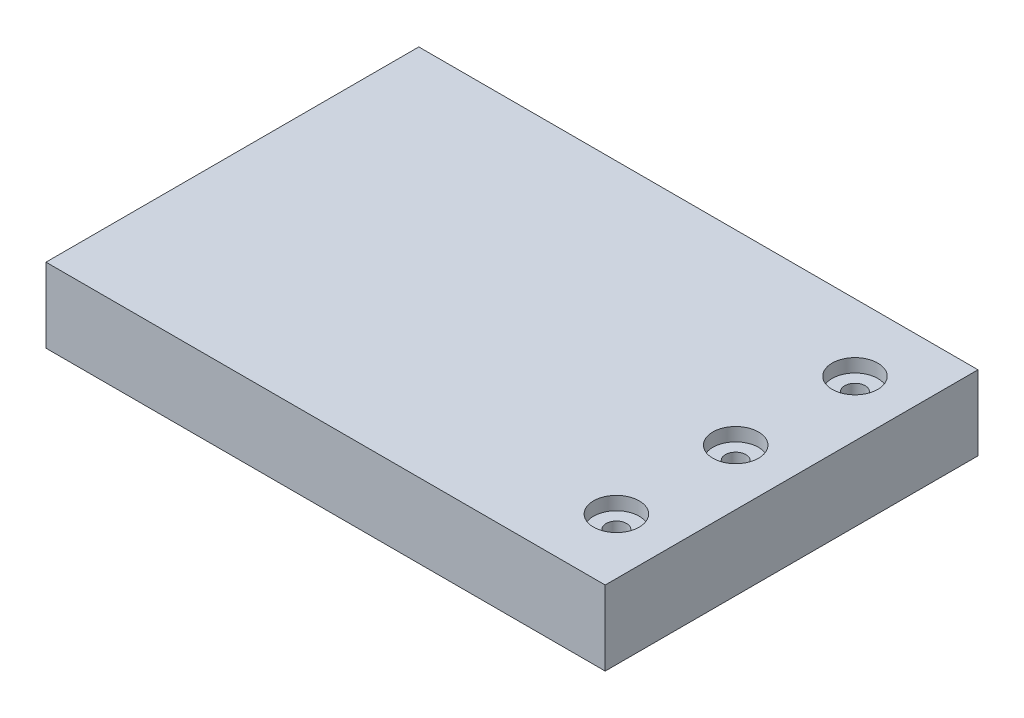
from build123d import *

# Parameters (mm, degrees)
SKETCH1_W                               = 150
SKETCH1_H                               = 100
BOSS_EXTRUDE1_DEPTH                     = 20
CBORE_FOR_M5_HEX_HEAD_BOLT1_D           = 5.5
CBORE_FOR_M5_HEX_HEAD_BOLT1_DEPTH       = 15
CBORE_FOR_M5_HEX_HEAD_BOLT1_CBORE_D     = 12.24
CBORE_FOR_M5_HEX_HEAD_BOLT1_CBORE_DEPTH = 3.58
CBORE_FOR_M5_HEX_HEAD_BOLT1_TIP         = 1.652366702
SHELL1_START                            = 1.4
SHELL1_OUTLINE_W                        = 147.2
SHELL1_OUTLINE_H                        = 97.2
SHELL1_OUTLINE_R                        = 7.52
SHELL1_DEPTH                            = 17.2
SHELL1_2_OUTLINE_R                      = 7.52
SHELL1_2_OUTLINE_R_2                    = 4.15
SHELL1_2_DEPTH                          = 13.62
SHELL1_3_OUTLINE_R                      = 4.15
SHELL1_3_DEPTH                          = 0.314346442


with BuildPart() as part:
    # Sketch1 → Boss-Extrude1 (new body)
    with BuildSketch(Plane(origin=(0, 0, 0), x_dir=(1, 0, 0), z_dir=(0, 1, 0))):
        Rectangle(SKETCH1_W, SKETCH1_H)
    extrude(amount=BOSS_EXTRUDE1_DEPTH)

    # CBORE for M5 Hex Head Bolt1
    with Locations(Plane(origin=(0, 20, 0), x_dir=(1, 0, 0), z_dir=(0, 1, 0))):
        with Locations((60, 0), (60, 32), (60, -32)):
            CounterBoreHole(CBORE_FOR_M5_HEX_HEAD_BOLT1_D / 2, CBORE_FOR_M5_HEX_HEAD_BOLT1_CBORE_D / 2, CBORE_FOR_M5_HEX_HEAD_BOLT1_CBORE_DEPTH, depth=CBORE_FOR_M5_HEX_HEAD_BOLT1_DEPTH)
            with Locations((0, 0, -(CBORE_FOR_M5_HEX_HEAD_BOLT1_DEPTH + CBORE_FOR_M5_HEX_HEAD_BOLT1_TIP / 2))):  # 118° drill point
                Cone(0, CBORE_FOR_M5_HEX_HEAD_BOLT1_D / 2, CBORE_FOR_M5_HEX_HEAD_BOLT1_TIP, mode=Mode.SUBTRACT)

    # Shell1: read off the stored shape, not the designer's step
    # Shell1 outline → Shell1 (cut)
    with BuildSketch(Plane(origin=(0, 0, 0), x_dir=(1, 0, 0), z_dir=(0, 1, 0)).offset(SHELL1_START)):
        Rectangle(SHELL1_OUTLINE_W, SHELL1_OUTLINE_H)
        with Locations((60, -32)):
            Circle(SHELL1_OUTLINE_R, mode=Mode.SUBTRACT)
        with Locations((60, 0)):
            Circle(SHELL1_OUTLINE_R, mode=Mode.SUBTRACT)
        with Locations((60, 32)):
            Circle(SHELL1_OUTLINE_R, mode=Mode.SUBTRACT)
    extrude(amount=SHELL1_DEPTH, mode=Mode.SUBTRACT)

    # Shell1 2 outline → Shell1 2 (cut)
    # profile 1 of 3: a face of its own
    with BuildSketch(Plane(origin=(0, 0, 0), x_dir=(1, 0, 0), z_dir=(0, 1, 0)).offset(SHELL1_START)):
        with Locations((60, -32)):
            Circle(SHELL1_2_OUTLINE_R)
        with Locations((60, -32)):
            Circle(SHELL1_2_OUTLINE_R_2, mode=Mode.SUBTRACT)
    # profile 2 of 3: a face of its own
    with BuildSketch(Plane(origin=(0, 0, 0), x_dir=(1, 0, 0), z_dir=(0, 1, 0)).offset(SHELL1_START)):
        with Locations((60, 32)):
            Circle(SHELL1_2_OUTLINE_R)
        with Locations((60, 32)):
            Circle(SHELL1_2_OUTLINE_R_2, mode=Mode.SUBTRACT)
    # profile 3 of 3: a face of its own
    with BuildSketch(Plane(origin=(0, 0, 0), x_dir=(1, 0, 0), z_dir=(0, 1, 0)).offset(SHELL1_START)):
        with Locations((60, 0)):
            Circle(SHELL1_2_OUTLINE_R)
        with Locations((60, 0)):
            Circle(SHELL1_2_OUTLINE_R_2, mode=Mode.SUBTRACT)
    extrude(amount=SHELL1_2_DEPTH, mode=Mode.SUBTRACT)

    # Shell1 3 outline → Shell1 3 (cut)
    with BuildSketch(Plane(origin=(0, 0, 0), x_dir=(1, 0, 0), z_dir=(0, 1, 0)).offset(SHELL1_START)):
        with Locations((60, -32)):
            Circle(SHELL1_3_OUTLINE_R)
        with Locations((60, 32)):
            Circle(SHELL1_3_OUTLINE_R)
        with Locations((60, 0)):
            Circle(SHELL1_3_OUTLINE_R)
    extrude(amount=SHELL1_3_DEPTH, mode=Mode.SUBTRACT)

    # Shell1 4 outline → Shell1 4 (revolve, cut)
    with BuildSketch(Plane(origin=(60, 0, 32), x_dir=(1, 0, 0), z_dir=(0, 0, 1))):
        Polygon((4.15, 4.207918111), (0, 1.714346542), (4.15, 1.714346442), align=None)
    revolve(axis=Axis((60, 0, 32), (0, 1, 0)), mode=Mode.SUBTRACT)

    # Shell1 5 outline → Shell1 5 (revolve, cut)
    with BuildSketch(Plane(origin=(60, 0, -32), x_dir=(1, 0, 0), z_dir=(0, 0, 1))):
        Polygon((4.15, 4.207918111), (0, 1.714346542), (4.15, 1.714346442), align=None)
    revolve(axis=Axis((60, 0, -32), (0, 1, 0)), mode=Mode.SUBTRACT)

    # Shell1 6 outline → Shell1 6 (revolve, cut)
    with BuildSketch(Plane(origin=(60, 0, 0), x_dir=(1, 0, 0), z_dir=(0, 0, 1))):
        Polygon((4.15, 4.207918111), (0, 1.714346542), (4.15, 1.714346442), align=None)
    revolve(axis=Axis((60, 0, 0), (0, 1, 0)), mode=Mode.SUBTRACT)


solid = part.part
